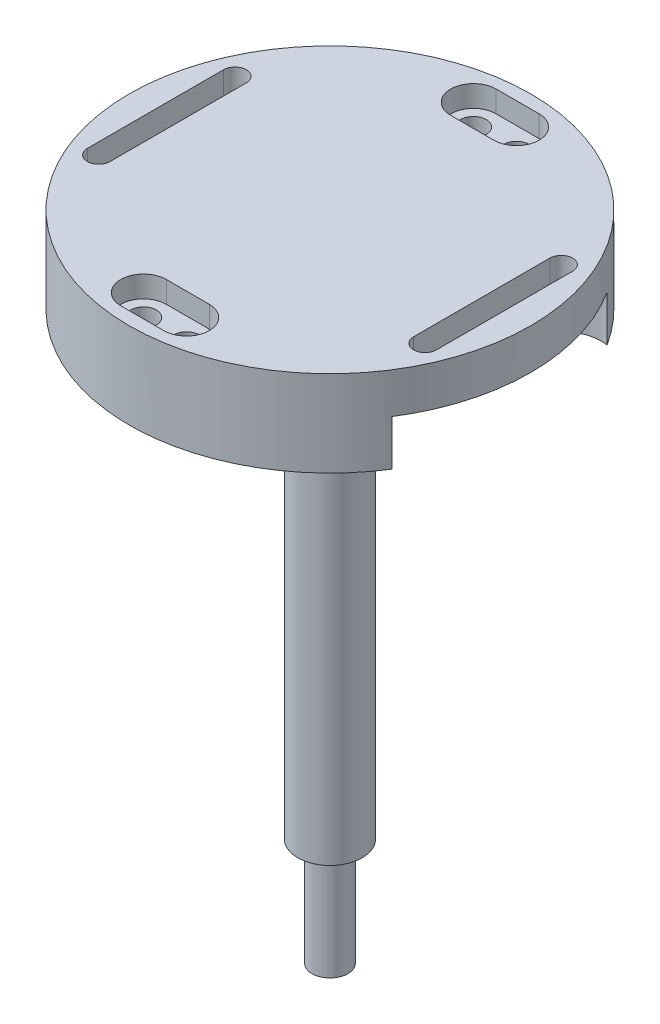
from build123d import *

# Parameters (mm, degrees)
CBORE_FOR_M3_SHCS1_D           = 3.6
CBORE_FOR_M3_SHCS1_CBORE_D     = 6.35
CBORE_FOR_M3_SHCS1_CBORE_DEPTH = 3
CUT_EXTRUDE1_DEPTH             = 97.498704587
CUT_EXTRUDE2_DEPTH             = 100.242128083
CUT_EXTRUDE3_DEPTH             = 6.35


with BuildPart() as part:
    # Sketch1 → Revolve1 (revolve)
    with BuildSketch(Plane.XY):
        Polygon((0, 90.999999926), (28, 90.999999926), (28, 78.999999926), (15, 78.999999926), (15, 79.999999926), (4.5, 79.999999926), (4.5, 15), (2.5, 15), (2.5, 0), (0, 0), align=None)
    revolve(axis=Axis((0, 0, 0), (0, 1, 0)))

    # CBORE for M3 SHCS1 (through all)
    with Locations(Plane(origin=(0, 90.999999926, 0), x_dir=(1, 0, 0), z_dir=(0, 1, 0))):
        with Locations((3, 23), (-3, 23), (-3, -23), (3, -23)):
            CounterBoreHole(CBORE_FOR_M3_SHCS1_D / 2, CBORE_FOR_M3_SHCS1_CBORE_D / 2, CBORE_FOR_M3_SHCS1_CBORE_DEPTH)

    # Sketch4 → Cut-Extrude1 (cut, through all)
    with BuildSketch(Plane(origin=(0, 87.999999926, 0), x_dir=(1, 0, 0), z_dir=(0, 1, 0))):
        with BuildLine():
            Line((-3, 26.175), (3, 26.175))
            ThreePointArc((3, 26.175), (6.175, 23), (3, 19.825))
            Line((3, 19.825), (-3, 19.825))
            ThreePointArc((-3, 19.825), (-6.175, 23), (-3, 26.175))
        make_face()
        with BuildLine():
            Line((-3, -19.825), (3, -19.825))
            ThreePointArc((3, -19.825), (6.175, -23), (3, -26.175))
            Line((3, -26.175), (-3, -26.175))
            ThreePointArc((-3, -26.175), (-6.175, -23), (-3, -19.825))
        make_face()
    extrude(amount=CUT_EXTRUDE1_DEPTH, mode=Mode.SUBTRACT)

    # Sketch5 → Cut-Extrude2 (cut, through all)
    with BuildSketch(Plane(origin=(0, 90.999999926, 0), x_dir=(1, 0, 0), z_dir=(0, 1, 0))):
        with BuildLine():
            Line((-24.3375, -9.5), (-24.3375, 9.5))
            ThreePointArc((-24.3375, 9.5), (-22.75, 11.0875), (-21.1625, 9.5))
            Line((-21.1625, 9.5), (-21.1625, -9.5))
            ThreePointArc((-21.1625, -9.5), (-22.75, -11.0875), (-24.3375, -9.5))
        make_face()
    cut_extrude2 = extrude(amount=-CUT_EXTRUDE2_DEPTH, mode=Mode.SUBTRACT)

    # Mirror1: Cut-Extrude2 across plane
    add(cut_extrude2.mirror(Plane(origin=(0, 0, 0), x_dir=(0, 0, 1), z_dir=(1, 0, 0))), mode=Mode.SUBTRACT)

    # Sketch7 → Cut-Extrude3 (cut)
    with BuildSketch(Plane.XZ.offset(-78.999999926)):
        with BuildLine():
            Line((28.30625, 9.5), (28.30625, -9.5))
            ThreePointArc((28.30625, -9.5), (22.75, -15.05625), (17.19375, -9.5))
            Line((17.19375, -9.5), (17.19375, 9.5))
            ThreePointArc((17.19375, 9.5), (22.75, 15.05625), (28.30625, 9.5))
        make_face()
        with BuildLine():
            Line((-17.19375, -9.5), (-17.19375, 9.5))
            ThreePointArc((-17.19375, 9.5), (-22.75, 15.05625), (-28.30625, 9.5))
            Line((-28.30625, 9.5), (-28.30625, -9.5))
            ThreePointArc((-28.30625, -9.5), (-22.75, -15.05625), (-17.19375, -9.5))
        make_face()
    extrude(amount=-CUT_EXTRUDE3_DEPTH, mode=Mode.SUBTRACT)


solid = part.part
